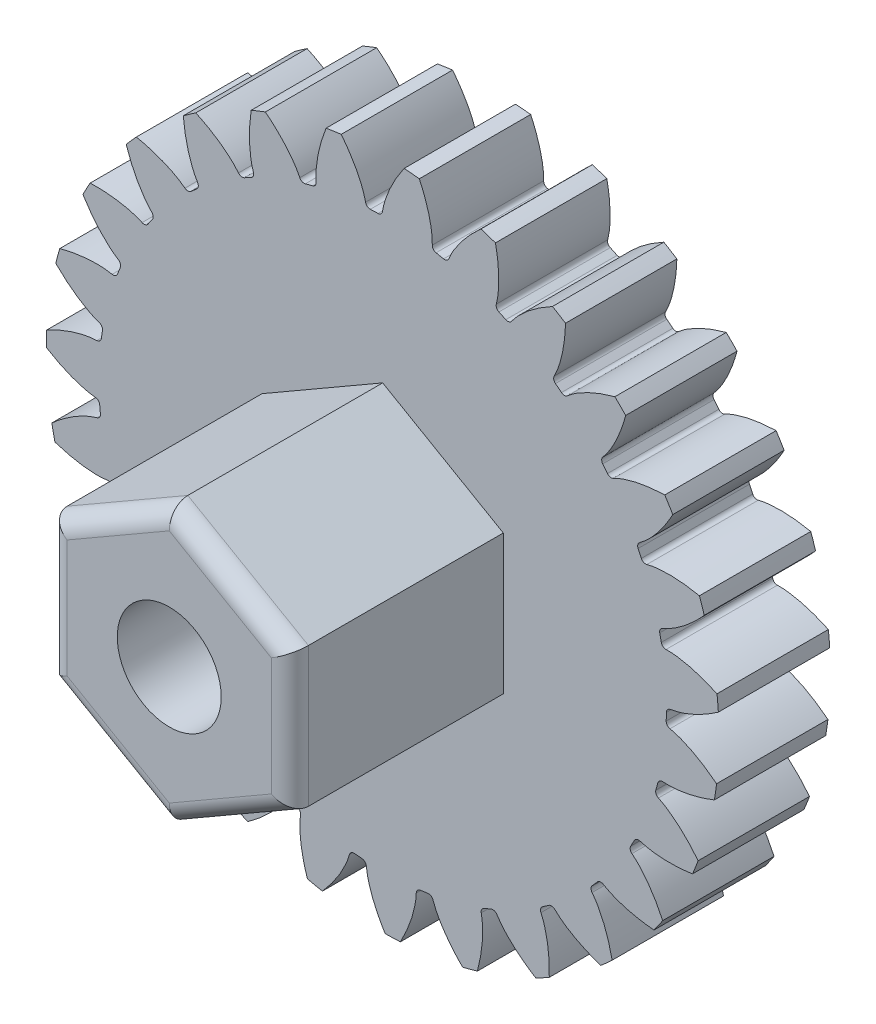
from build123d import *

# Parameters (mm, degrees)
SKETCH2_R                = 18.125
BOSS_EXTRUDE1_DEPTH      = 6
CUT_EXTRUDE1_DEPTH       = 6
FILLET1_R                = 0.254
CIRPATTERN3_COUNT        = 27
FILLET1_OF_CIRPATTERN3_R = 0.254
BOSS_EXTRUDE2_DEPTH      = 11.5
SKETCH4_R                = 2.8
CUT_EXTRUDE2_DEPTH       = 32.036335424
FILLET2_R                = 1


# Read off the part's stored shape, not the designer's step: Cut-Extrude1
with BuildPart() as part:
    # Sketch2 → Boss-Extrude1 (new body)
    with BuildSketch(Plane.XY):
        Circle(SKETCH2_R)
    extrude(amount=BOSS_EXTRUDE1_DEPTH)

    # Cut-Extrude1 outline → Cut-Extrude1 (cut)
    with BuildSketch(Plane.XY):
        with BuildLine():
            add(Edge.make_bspline(
                [(15.293943906, 0), (15.305253299, 0), (15.336964339, 0.00074082), (15.396845119, 0.005066139), (15.494240284, 0.016267993), (15.617714722, 0.036610689), (15.776289364, 0.069834677), (15.961506744, 0.117828662), (16.163035486, 0.179773153), (16.379749283, 0.256988095), (16.59342961, 0.342624014), (16.803983292, 0.435958219), (17.011216032, 0.536009953), (17.259008351, 0.665439426), (17.551466226, 0.832023435), (17.793413557, 0.984652677), (17.98203981, 1.112094263), (18.081230118, 1.181579697), (18.086216109, 1.185078834)],
                knots=[0, 0, 0, 0, 0, 0.005376748, 0.015083688, 0.02853182, 0.046610139, 0.064854849, 0.092110525, 0.119476175, 0.146842495, 0.174208853, 0.201574955, 0.228941013, 0.256307345, 0.307035032, 0.361767351, 0.364665932, 0.364665932, 0.364665932, 0.364665932, 0.364665932], degree=4))
            Line((15.293943906, 0), (15.269621682, -0.86219134))
            add(Edge.make_bspline(
                [(17.990644834, -2.202799001), (17.985864036, -2.199024345), (17.890748691, -2.124057592), (17.709606894, -1.986184932), (17.476648761, -1.820158714), (17.194047109, -1.637352405), (16.953945405, -1.49415955), (16.752682616, -1.382584249), (16.547725468, -1.277528577), (16.339212659, -1.179982683), (16.127196474, -1.090673365), (15.929480328, -1.017466265), (15.747263149, -0.959107033), (15.590813683, -0.916996286), (15.468682422, -0.889725108), (15.372073647, -0.873050446), (15.312531935, -0.865356246), (15.280913089, -0.862828904), (15.269621682, -0.86219134)],
                knots=[0.544424984, 0.544424984, 0.544424984, 0.544424984, 0.544424984, 0.547323565, 0.602055884, 0.652783571, 0.680149903, 0.707515961, 0.734882063, 0.762248421, 0.789614741, 0.816980391, 0.844236067, 0.862480777, 0.880559096, 0.894007228, 0.903714168, 0.909090916, 0.909090916, 0.909090916, 0.909090916, 0.909090916], degree=4))
            ThreePointArc((17.990644834, -2.202799001), (18.117792441, -0.511098867), (18.086216109, 1.185078834))
        make_face()
    cut_extrude1 = extrude(amount=CUT_EXTRUDE1_DEPTH, mode=Mode.SUBTRACT)

    # Fillet1
    fillet1_edges = [part.edges().sort_by_distance(p)[0] for p in [
        (15.269621682, -0.86219134, 3),
        (15.293943906, 0, 3),
    ]]
    fillet(fillet1_edges, radius=FILLET1_R)

    # CirPattern3: Cut-Extrude1 ×27 about axis
    cirpattern3_axis = Axis((0, 0, 18.908609159), (0, 0, -1))
    for i in range(1, CIRPATTERN3_COUNT):
        add(cut_extrude1.rotate(cirpattern3_axis, i * 360 / CIRPATTERN3_COUNT), mode=Mode.SUBTRACT)

    # Fillet1 of CirPattern3
    fillet1_of_cirpattern3_edges = [part.edges().sort_by_distance(p)[0] for p in [
        (14.659192047, -4.360367961, 3),
        (14.881693669, -3.527026191, 3),
        (13.258481574, -7.623476016, 3),
        (13.667167474, -6.863909487, 3),
        (11.143002927, -10.475600507, 3),
        (11.715840743, -9.830757646, 3),
        (8.426802109, -12.762982662, 3),
        (9.132910004, -12.267627116, 3),
        (5.256310208, -14.362309119, 3),
        (6.057621724, -14.043145632, 3),
        (1.802449263, -15.187359773, 3),
        (2.655765489, -15.061594533, 3),
        (-1.748582189, -15.193655931, 3),
        (-0.889263752, -15.268068974, 3),
        (-5.205347122, -14.380858165, 3),
        (-4.386352553, -14.651437864, 3),
        (-8.381490444, -12.792784613, 3),
        (-7.646971953, -13.244943947, 3),
        (-11.105785447, -10.515048731, 3),
        (-10.495341116, -11.124411673, 3),
        (-13.231364682, -7.67044385, 3),
        (-12.777903722, -8.404159486, 3),
        (-14.643637622, -4.412323356, 3),
        (-14.371606231, -5.230836887, 3),
        (-15.266468268, -0.916333368, 3),
        (-15.190531729, -1.775518517, 3),
        (-15.066279658, 2.629056389, 3),
        (-15.190531729, 1.775518517, 3),
        (-14.053864011, 6.032713036, 3),
        (-14.371606231, 5.230836887, 3),
        (-12.283800918, 9.111144562, 3),
        (-12.777903722, 8.404159486, 3),
        (-9.851514938, 11.698391926, 3),
        (-10.495341116, 11.124411673, 3),
        (-6.888131238, 13.654975953, 3),
        (-7.646971953, 13.244943947, 3),
        (-3.553406599, 14.875416692, 3),
        (-4.386352553, 14.651437864, 3),
        (-0.027116892, 15.293919867, 3),
        (-0.889263752, 15.268068974, 3),
        (3.500634695, 14.887923863, 3),
        (2.655765489, 15.061594533, 3),
        (6.839666159, 13.67931603, 3),
        (6.057621724, 14.043145632, 3),
        (9.80996945, 11.733252729, 3),
        (9.132910004, 12.267627116, 3),
        (12.251414749, 9.154646737, 3),
        (11.715840743, 9.830757646, 3),
        (14.032383107, 6.082511369, 3),
        (13.667167474, 6.863909487, 3),
        (15.05686206, 2.682466239, 3),
        (14.881693669, 3.527026191, 3),
    ]]
    fillet(fillet1_of_cirpattern3_edges, radius=FILLET1_OF_CIRPATTERN3_R)

    # Sketch3 → Boss-Extrude2 (add)
    with BuildSketch(Plane.XY.offset(6)):
        Polygon((0, 7.505553499), (-6.5, 3.75277675), (-6.5, -3.75277675), (0, -7.505553499), (6.5, -3.75277675), (6.5, 3.75277675), align=None)
    extrude(amount=BOSS_EXTRUDE2_DEPTH)

    # Sketch4 → Cut-Extrude2 (cut, through all)
    with BuildSketch(Plane.XY.offset(17.5)):
        Circle(SKETCH4_R)
    extrude(amount=-CUT_EXTRUDE2_DEPTH, mode=Mode.SUBTRACT)

    # Fillet2
    fillet2_edges = [part.edges().sort_by_distance(p)[0] for p in [
        (3.25, 5.629165125, 17.5),
        (-3.25, 5.629165125, 17.5),
        (-6.5, 0, 17.5),
        (-3.25, -5.629165125, 17.5),
        (3.25, -5.629165125, 17.5),
        (6.5, 0, 17.5),
    ]]
    fillet(fillet2_edges, radius=FILLET2_R)


solid = part.part
